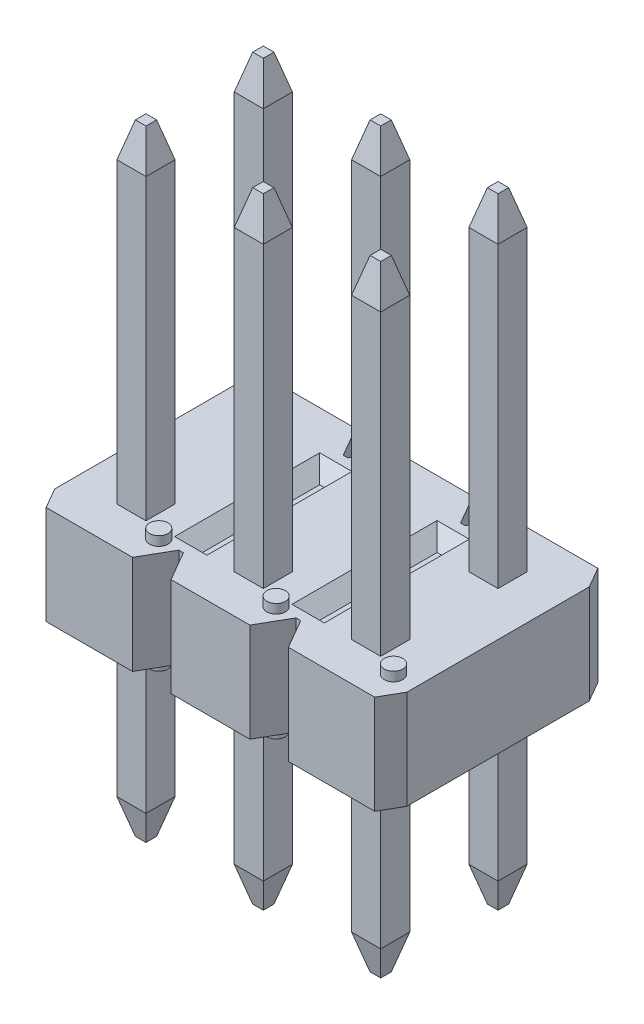
from build123d import *

# Parameters (mm, degrees)
BOSS_EXTRUDE1_DEPTH      = 2.14
BOSS_EXTRUDE2_START      = -2.34
SKETCH2_R                = 0.2
BOSS_EXTRUDE2_DEPTH      = 2.54
LPATTERN1_COUNT          = 3
LPATTERN1_PITCH          = 2.54
SKETCH3_W                = 0.1
SKETCH3_H                = 2.54
CUT_EXTRUDE1_DEPTH       = 0.3
CHAMFER1_SIZE            = 0.3
CHAMFER1_OF_MIRROR2_SIZE = 0.3
SKETCH6_W                = 0.63
SKETCH6_H                = 0.63
CHAMFER2_SIZE            = 0.2
CHAMFER2_SIZE2           = 0.746410162
CHAMFER3_SIZE            = 0.2
CHAMFER3_SIZE2           = 0.746410162
LPATTERN2_START          = -1.585
LPATTERN2_DEPTH          = 0.63
LPATTERN2_START_2        = -1
LPATTERN2_2_DEPTH        = 5
MIRROR4_START            = -2.655
MIRROR4_DEPTH            = 0.23
MIRROR4_START_2          = -0.115
MIRROR4_2_DEPTH          = 0.23
MIRROR4_START_3          = 2.425
MIRROR4_3_DEPTH          = 0.23
MIRROR4_START_4          = 0.955
MIRROR4_4_DEPTH          = 0.63
MIRROR4_START_5          = -4
MIRROR4_5_DEPTH          = 8


with BuildPart() as part:
    # Sketch1 → Boss-Extrude1 (new body)
    with BuildSketch(Plane(origin=(0, 1.36, 0), x_dir=(1, 0, 0), z_dir=(0, 1, 0))):
        Polygon((-1.686617421, 2.415), (-1.32, 1.78), (-1.22, 1.78), (-0.853382579, 2.415), (0.853382579, 2.415), (1.22, 1.78), (1.32, 1.78), (1.686617421, 2.415), (3.556, 2.415), (3.81, 1.975059095), (3.81, -1.975059095), (3.556, -2.415), (1.686617421, -2.415), (1.32, -1.78), (1.22, -1.78), (0.853382579, -2.415), (-0.853382579, -2.415), (-1.22, -1.78), (-1.32, -1.78), (-1.686617421, -2.415), (-3.556, -2.415), (-3.81, -1.975059095), (-3.81, 1.975059095), (-3.556, 2.415), align=None)
    extrude(amount=BOSS_EXTRUDE1_DEPTH)

    # Sketch2 → Boss-Extrude2 (add)
    with BuildSketch(Plane(origin=(0, 3.5, 0), x_dir=(1, 0, 0), z_dir=(0, 1, 0)).offset(BOSS_EXTRUDE2_START)):
        with Locations(Location((-3.3325, 1.785, 0), (0, 0, 270))):
            Circle(SKETCH2_R)
        with Locations(Location((-1.7475, -1.785, 0), (0, 0, 270))):
            Circle(SKETCH2_R)
    boss_extrude2 = extrude(amount=BOSS_EXTRUDE2_DEPTH)

    # LPattern1: Boss-Extrude2 ×3
    with Locations(*[(i * LPATTERN1_PITCH, 0, 0) for i in range(1, LPATTERN1_COUNT)]):
        add(boss_extrude2)

    # Sketch3 → Cut-Extrude1 (cut)
    with BuildSketch(Plane(origin=(0, 3.5, 0), x_dir=(1, 0, 0), z_dir=(0, 1, 0))):
        with Locations((-1.27, 0)):
            Rectangle(SKETCH3_W, SKETCH3_H)
        with Locations((1.27, 0)):
            Rectangle(SKETCH3_W, SKETCH3_H)
    cut_extrude1 = extrude(amount=-CUT_EXTRUDE1_DEPTH, mode=Mode.SUBTRACT)

    # Chamfer1
    chamfer1_edges = [part.edges().sort_by_distance(p)[0] for p in [
        (-1.27, 3.5, 1.27),
        (-1.22, 3.5, 0),
        (-1.27, 3.5, -1.27),
        (-1.32, 3.5, 0),
        (1.27, 3.5, 1.27),
        (1.32, 3.5, 0),
        (1.22, 3.5, 0),
        (1.27, 3.5, -1.27),
    ]]
    chamfer(chamfer1_edges, length=CHAMFER1_SIZE - 0.0001)  # a hair under: the kernel refuses the full size

    # Mirror2: Cut-Extrude1 across plane
    add(cut_extrude1.mirror(Plane.ZX.offset(2.43)), mode=Mode.SUBTRACT)

    # Chamfer1 of Mirror2
    chamfer1_of_mirror2_edges = [part.edges().sort_by_distance(p)[0] for p in [
        (-1.27, 1.36, 1.27),
        (-1.22, 1.36, 0),
        (-1.27, 1.36, -1.27),
        (-1.32, 1.36, 0),
        (1.27, 1.36, 1.27),
        (1.32, 1.36, 0),
        (1.22, 1.36, 0),
        (1.27, 1.36, -1.27),
    ]]
    chamfer(chamfer1_of_mirror2_edges, length=CHAMFER1_OF_MIRROR2_SIZE - 0.0001)  # a hair under: the kernel refuses the full size

    # Sweep1: sweep along a path in Sketch5
    with BuildLine(Plane(origin=(-2.54, 0, 0), x_dir=(0, 0, -1), z_dir=(1, 0, 0))) as sweep1_path:
        Line((1.27, 10.7), (1.27, -2.73))
    # Sketch6 → Sweep1 (sweep)
    with BuildSketch(Plane(origin=(0, 10.7, 0), x_dir=(1, 0, 0), z_dir=(0, 1, 0))):
        with Locations((-2.54, 1.27)):
            Rectangle(SKETCH6_W, SKETCH6_H)
    sweep(path=sweep1_path.line)

    # Chamfer2
    chamfer2_edges = [part.edges().sort_by_distance(p)[0] for p in [
        (-2.225, -2.73, -1.27),
        (-2.54, -2.73, -0.955),
        (-2.855, -2.73, -1.27),
        (-2.54, -2.73, -1.585),
    ]]
    chamfer2_side = [part.faces().sort_by_distance(p)[0] for p in [
        (-2.54, -2.73, -1.27),
    ]]
    chamfer(chamfer2_edges, length=CHAMFER2_SIZE, length2=CHAMFER2_SIZE2, reference=chamfer2_side[0])

    # Chamfer3
    chamfer3_edges = [part.edges().sort_by_distance(p)[0] for p in [
        (-2.225, 10.7, -1.27),
        (-2.54, 10.7, -1.585),
        (-2.855, 10.7, -1.27),
        (-2.54, 10.7, -0.955),
    ]]
    chamfer3_side = [part.faces().sort_by_distance(p)[0] for p in [
        (-2.54, 10.7, -1.27),
    ]]
    chamfer(chamfer3_edges, length=CHAMFER3_SIZE, length2=CHAMFER3_SIZE2, reference=chamfer3_side[0])

    # LPattern2: read off the stored shape, not the designer's step
    # LPattern2 outline → LPattern2 (add)
    with BuildSketch(Plane.XY.offset(LPATTERN2_START)):
        Polygon((2.225, 9.953589838), (2.225, 3.5), (2.855, 3.5), (2.855, 9.953589838), (2.655, 10.7), (2.425, 10.7), align=None)
        Polygon((0.115, 10.7), (-0.115, 10.7), (-0.315, 9.953589838), (-0.315, 3.5), (0.315, 3.5), (0.315, 9.953589838), align=None)
        Polygon((-0.315, -1.983589838), (-0.115, -2.73), (0.115, -2.73), (0.315, -1.983589838), (0.315, 1.36), (-0.315, 1.36), align=None)
        Polygon((2.855, 1.36), (2.225, 1.36), (2.225, -1.983589838), (2.425, -2.73), (2.655, -2.73), (2.855, -1.983589838), align=None)
    extrude(amount=LPATTERN2_DEPTH)

    # LPattern2 2 outline → LPattern2 2 (cut)
    with BuildSketch(Plane.YZ.offset(LPATTERN2_START_2)):
        Polygon((-2.73, -0.955), (-2.73, -1.155), (-1.983589838, -0.955), align=None)
        Polygon((-1.983589838, -1.585), (-2.73, -1.385), (-2.73, -1.585), align=None)
        Polygon((9.953589838, -0.955), (10.7, -1.155), (10.7, -0.955), align=None)
        Polygon((10.7, -1.385), (9.953589838, -1.585), (10.7, -1.585), align=None)
    extrude(amount=LPATTERN2_2_DEPTH, mode=Mode.SUBTRACT)

    # Mirror4: read off the stored shape, not the designer's step
    # Mirror4 outline → Mirror4 (add)
    with BuildSketch(Plane.YZ.offset(MIRROR4_START)):
        Polygon((10.7, 1.155), (10.7, 1.385), (9.953589838, 1.585), (3.5, 1.585), (3.5, 0.955), (9.953589838, 0.955), align=None)
        Polygon((-1.983589838, 1.585), (-2.73, 1.385), (-2.73, 1.155), (-1.983589838, 0.955), (1.36, 0.955), (1.36, 1.585), align=None)
    extrude(amount=MIRROR4_DEPTH)

    # Mirror4 2 outline → Mirror4 2 (add)
    with BuildSketch(Plane.YZ.offset(MIRROR4_START_2)):
        Polygon((10.7, 1.155), (10.7, 1.385), (9.953589838, 1.585), (3.5, 1.585), (3.5, 0.955), (9.953589838, 0.955), align=None)
        Polygon((-1.983589838, 1.585), (-2.73, 1.385), (-2.73, 1.155), (-1.983589838, 0.955), (1.36, 0.955), (1.36, 1.585), align=None)
    extrude(amount=MIRROR4_2_DEPTH)

    # Mirror4 3 outline → Mirror4 3 (add)
    with BuildSketch(Plane.YZ.offset(MIRROR4_START_3)):
        Polygon((10.7, 1.155), (10.7, 1.385), (9.953589838, 1.585), (3.5, 1.585), (3.5, 0.955), (9.953589838, 0.955), align=None)
        Polygon((-1.983589838, 1.585), (-2.73, 1.385), (-2.73, 1.155), (-1.983589838, 0.955), (1.36, 0.955), (1.36, 1.585), align=None)
    extrude(amount=MIRROR4_3_DEPTH)

    # Mirror4 4 outline → Mirror4 4 (add)
    with BuildSketch(Plane.XY.offset(MIRROR4_START_4)):
        Polygon((-2.655, 1.36), (-2.855, 1.36), (-2.855, -1.983589838), (-2.655, -2.73), align=None)
        Polygon((2.855, 1.36), (2.655, 1.36), (2.655, -2.73), (2.855, -1.983589838), align=None)
        Polygon((2.425, 1.36), (2.225, 1.36), (2.225, -1.983589838), (2.425, -2.73), align=None)
        Polygon((0.315, 1.36), (0.115, 1.36), (0.115, -2.73), (0.315, -1.983589838), align=None)
        Polygon((-0.115, 1.36), (-0.315, 1.36), (-0.315, -1.983589838), (-0.115, -2.73), align=None)
        Polygon((-2.225, 1.36), (-2.425, 1.36), (-2.425, -2.73), (-2.225, -1.983589838), align=None)
        Polygon((-2.655, 10.7), (-2.855, 9.953589838), (-2.855, 3.5), (-2.655, 3.5), align=None)
        Polygon((2.655, 10.7), (2.655, 3.5), (2.855, 3.5), (2.855, 9.953589838), align=None)
        Polygon((2.225, 9.953589838), (2.225, 3.5), (2.425, 3.5), (2.425, 10.7), align=None)
        Polygon((0.115, 10.7), (0.115, 3.5), (0.315, 3.5), (0.315, 9.953589838), align=None)
        Polygon((-0.315, 9.953589838), (-0.315, 3.5), (-0.115, 3.5), (-0.115, 10.7), align=None)
        Polygon((-2.425, 10.7), (-2.425, 3.5), (-2.225, 3.5), (-2.225, 9.953589838), align=None)
    extrude(amount=MIRROR4_4_DEPTH)

    # Mirror4 5 outline → Mirror4 5 (cut)
    with BuildSketch(Plane.YZ.offset(MIRROR4_START_5)):
        Polygon((-2.73, 1.155), (-2.73, 0.955), (-1.983589838, 0.955), align=None)
        Polygon((-2.73, 1.585), (-2.73, 1.385), (-1.983589838, 1.585), align=None)
        Polygon((10.7, 1.585), (9.953589838, 1.585), (10.7, 1.385), align=None)
        Polygon((10.7, 1.155), (9.953589838, 0.955), (10.7, 0.955), align=None)
    extrude(amount=MIRROR4_5_DEPTH, mode=Mode.SUBTRACT)


solid = part.part
